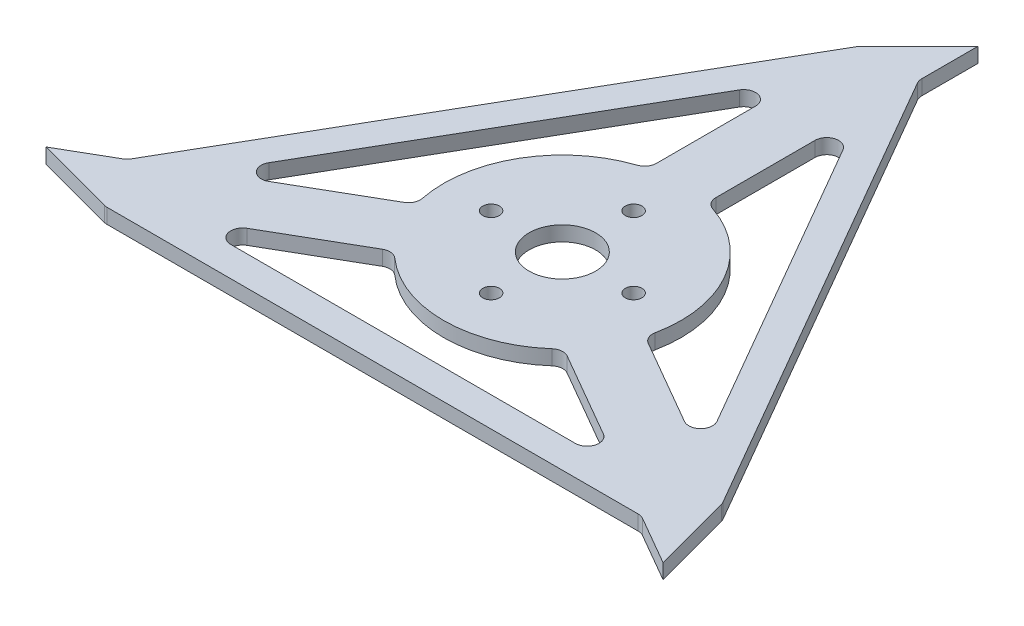
from build123d import *

# Parameters (mm, degrees)
BOSS_EXTRUDE1_DEPTH = 3.175
SKETCH2_R           = 7.112
SKETCH2_R_2         = 1.778
CUT_EXTRUDE1_DEPTH  = 112.353063031
FILLET1_R           = 2.54


with BuildPart() as part:
    # Sketch1 → Boss-Extrude1 (new body)
    with BuildSketch(Plane(origin=(0, 0, 0), x_dir=(1, 0, 0), z_dir=(0, 1, 0))):
        Polygon((6.35, 82.55), (-6.35, 69.85), (-63.666874454, -29.425738686), (-74.665397082, -35.775738686), (-57.316874454, -40.424261314), (57.316874454, -40.424261314), (68.315397082, -46.774261314), (63.666874454, -29.425738686), (6.35, 69.85), align=None)
        with BuildLine():
            Line((6.35, 24.593444248), (6.35, 57.15))
            Line((6.35, 57.15), (52.668351826, -23.075738686))
            Line((52.668351826, -23.075738686), (24.473547486, -6.79746081))
            ThreePointArc((24.473547486, -6.79746081), (21.997045256, 12.7), (6.35, 24.593444248))
        make_face(mode=Mode.SUBTRACT)
        with BuildLine():
            Line((-6.35, 57.15), (-6.35, 24.593444248))
            ThreePointArc((-6.35, 24.593444248), (-21.997045256, 12.7), (-24.473547486, -6.79746081))
            Line((-24.473547486, -6.79746081), (-52.668351826, -23.075738686))
            Line((-52.668351826, -23.075738686), (-6.35, 57.15))
        make_face(mode=Mode.SUBTRACT)
        with BuildLine():
            Line((18.123547486, -17.795983438), (46.318351826, -34.074261314))
            Line((46.318351826, -34.074261314), (-46.318351826, -34.074261314))
            Line((-46.318351826, -34.074261314), (-18.123547486, -17.795983438))
            ThreePointArc((-18.123547486, -17.795983438), (0, -25.4), (18.123547486, -17.795983438))
        make_face(mode=Mode.SUBTRACT)
    extrude(amount=BOSS_EXTRUDE1_DEPTH)

    # Sketch2 → Cut-Extrude1 (cut, through all)
    with BuildSketch(Plane(origin=(0, 3.175, 0), x_dir=(1, 0, 0), z_dir=(0, 1, 0))):
        Circle(SKETCH2_R)
        with Locations((0, 15.24)):
            Circle(SKETCH2_R_2)
        with Locations((15.24, 0)):
            Circle(SKETCH2_R_2)
        with Locations((0, -15.24)):
            Circle(SKETCH2_R_2)
        with Locations((-15.24, 0)):
            Circle(SKETCH2_R_2)
    extrude(amount=-CUT_EXTRUDE1_DEPTH, mode=Mode.SUBTRACT)

    # Fillet1
    fillet1_edges = [part.edges().sort_by_distance(p)[0] for p in [
        (-24.473547486, 1.5875, 6.79746081),
        (-6.35, 1.5875, -24.593444248),
        (6.35, 1.5875, -24.593444248),
        (24.473547486, 1.5875, 6.79746081),
        (18.123547486, 1.5875, 17.795983438),
        (-18.123547486, 1.5875, 17.795983438),
        (-6.35, 1.5875, -69.85),
        (-57.316874454, 1.5875, 40.424261314),
        (63.666874454, 1.5875, 29.425738686),
        (57.316874454, 1.5875, 40.424261314),
        (52.668351826, 1.5875, 23.075738686),
        (46.318351826, 1.5875, 34.074261314),
        (-63.666874454, 1.5875, 29.425738686),
        (-52.668351826, 1.5875, 23.075738686),
        (-46.318351826, 1.5875, 34.074261314),
        (6.35, 1.5875, -69.85),
        (6.35, 1.5875, -57.15),
        (-6.35, 1.5875, -57.15),
    ]]
    fillet(fillet1_edges, radius=FILLET1_R)


solid = part.part
